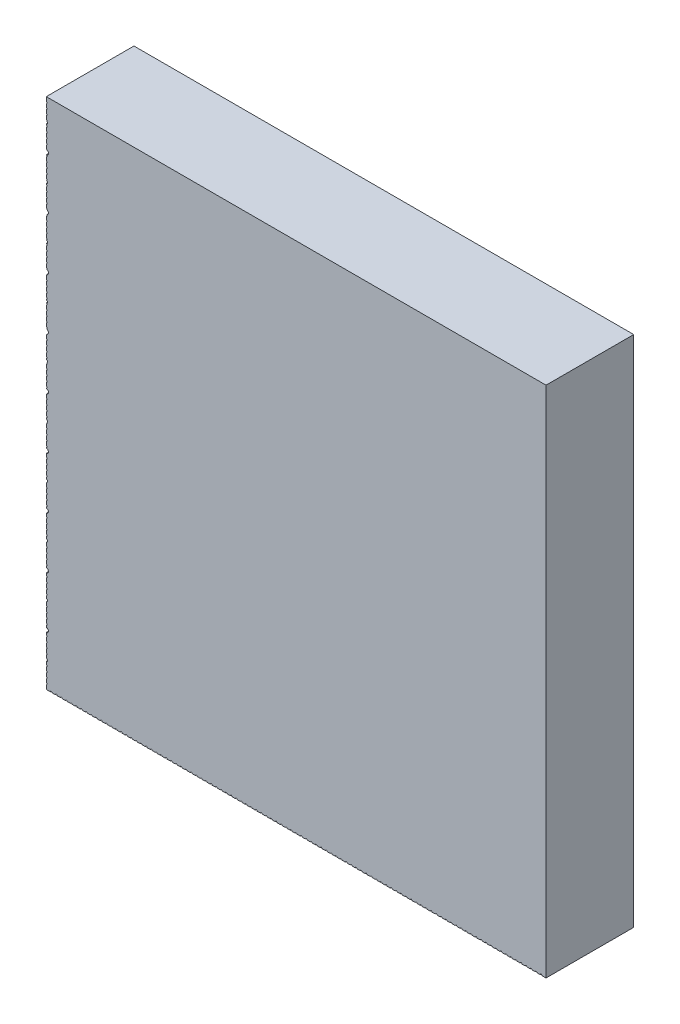
from build123d import *

# Parameters (mm, degrees)
SKETCH4_W           = 57
SKETCH4_H           = 58.5576333
BOSS_EXTRUDE2_DEPTH = 10
CUT_EXTRUDE1_DEPTH  = 10
LPATTERN1_COUNT     = 99
LPATTERN1_PITCH     = 0.57
SKETCH15_R          = 0.1
CUT_EXTRUDE2_DEPTH  = 10
LPATTERN2_COUNT     = 99
LPATTERN2_PITCH     = 0.585576333
SKETCH16_R          = 0.15
CUT_EXTRUDE3_DEPTH  = 10
LPATTERN3_COUNT     = 19
LPATTERN3_PITCH     = 2.95
SKETCH17_R          = 0.25
CUT_EXTRUDE4_DEPTH  = 10
LPATTERN4_COUNT     = 9
LPATTERN4_PITCH     = 5.9


with BuildPart() as part:
    # Sketch4 → Boss-Extrude2 (new body)
    with BuildSketch(Plane.XY):
        with Locations((28.5, 29.27881665)):
            Rectangle(SKETCH4_W, SKETCH4_H)
    extrude(amount=BOSS_EXTRUDE2_DEPTH)

    # Sketch14 → Cut-Extrude1 (cut)
    with BuildSketch(Plane.XY.offset(10)):
        with BuildLine():
            Line((0.47, 0), (0.67, 0))
            ThreePointArc((0.67, 0), (0.57, 0.1), (0.47, 0))
        make_face()
    cut_extrude1 = extrude(amount=-CUT_EXTRUDE1_DEPTH, mode=Mode.SUBTRACT)

    # LPattern1: Cut-Extrude1 ×99
    with Locations(*[(i * LPATTERN1_PITCH, 0, 0) for i in range(1, LPATTERN1_COUNT)]):
        add(cut_extrude1, mode=Mode.SUBTRACT)

    # Sketch15 → Cut-Extrude2 (cut)
    with BuildSketch(Plane.XY.offset(10)):
        with Locations((0, 0.58557633)):
            Circle(SKETCH15_R)
    cut_extrude2 = extrude(amount=-CUT_EXTRUDE2_DEPTH, mode=Mode.SUBTRACT)

    # LPattern2: Cut-Extrude2 ×99
    with Locations(*[(0, i * LPATTERN2_PITCH, 0) for i in range(1, LPATTERN2_COUNT)]):
        add(cut_extrude2, mode=Mode.SUBTRACT)

    # Sketch16 → Cut-Extrude3 (cut)
    with BuildSketch(Plane.XY.offset(10)):
        with Locations((0, 2.927881662)):
            Circle(SKETCH16_R)
    cut_extrude3 = extrude(amount=-CUT_EXTRUDE3_DEPTH, mode=Mode.SUBTRACT)

    # LPattern3: Cut-Extrude3 ×19
    with Locations(*[(0, i * LPATTERN3_PITCH, 0) for i in range(1, LPATTERN3_COUNT)]):
        add(cut_extrude3, mode=Mode.SUBTRACT)

    # Sketch17 → Cut-Extrude4 (cut)
    with BuildSketch(Plane.XY.offset(10)):
        with Locations((0, 5.877881662)):
            Circle(SKETCH17_R)
    cut_extrude4 = extrude(amount=-CUT_EXTRUDE4_DEPTH, mode=Mode.SUBTRACT)

    # LPattern4: Cut-Extrude4 ×9
    with Locations(*[(0, i * LPATTERN4_PITCH, 0) for i in range(1, LPATTERN4_COUNT)]):
        add(cut_extrude4, mode=Mode.SUBTRACT)


solid = part.part
